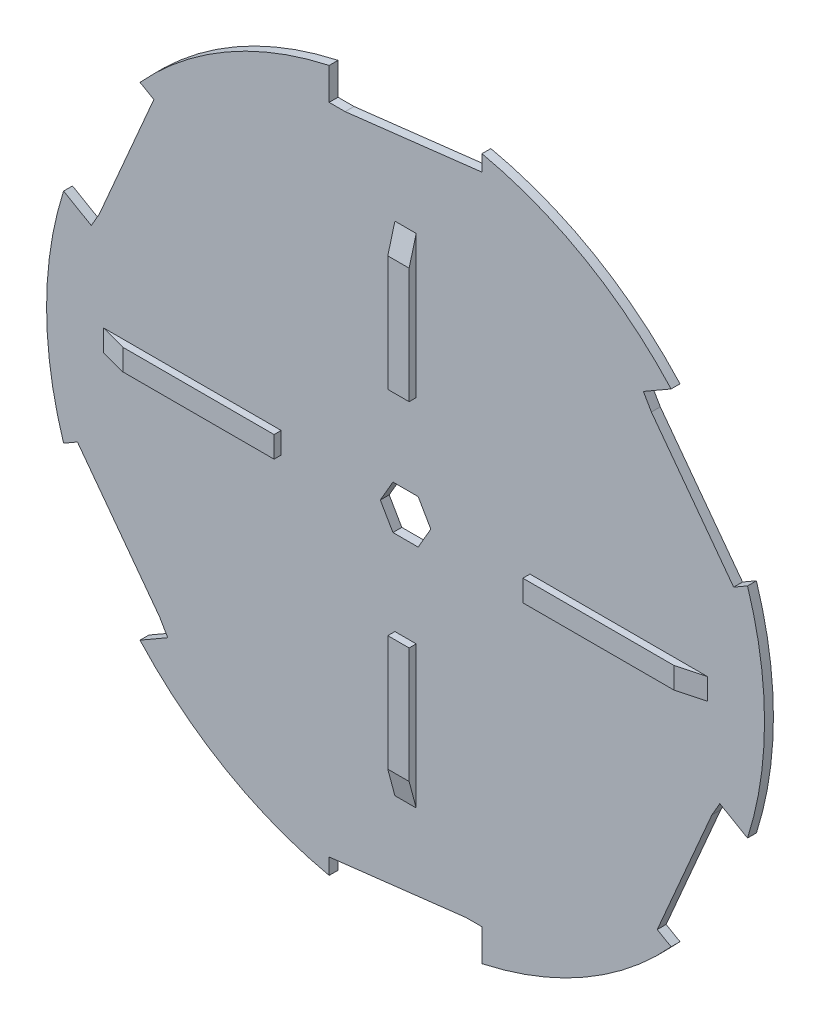
from build123d import *
from OCP.BRepFilletAPI import BRepFilletAPI_MakeChamfer

# Parameters (mm, degrees)
SKETCH1_R           = 101
BOSS_EXTRUDE1_DEPTH = 2.5
SKETCH8_W           = 1.221153846
SKETCH8_H           = 0.325641026
CUT_EXTRUDE6_DEPTH  = 0.2
CUT_EXTRUDE7_DEPTH  = 10
BOSS_EXTRUDE2_DEPTH = 2
CHAMFER1_SIZE       = 2
CHAMFER1_SIZE_2     = 7.464101615
CUT_EXTRUDE9_DEPTH  = 10


with BuildPart() as part:
    # Sketch1 → Boss-Extrude1 (new body)
    with BuildSketch(Plane.XY):
        Circle(SKETCH1_R)
    extrude(amount=BOSS_EXTRUDE1_DEPTH)

    # Sketch8 → Cut-Extrude6 (cut)
    # profile 1 of 12: a face of its own
    with BuildSketch(Plane(origin=(0, 0, 0), x_dir=(-1, 0, 0), z_dir=(0, 0, -1))):
        with BuildLine():
            add(Edge.make_bspline(
                [(-21.303796635, -42.5044388), (-21.303499075, -42.453550456), (-21.302921062, -42.354699113), (-21.296490852, -42.210658759), (-21.285808934, -42.075530497), (-21.271170032, -41.949307858), (-21.253355578, -41.831958258), (-21.229574387, -41.723795299), (-21.202529916, -41.62431837), (-21.171185911, -41.533203084), (-21.135818417, -41.449221882), (-21.09732448, -41.370821878), (-21.054176417, -41.298121696), (-21.008840217, -41.229960986), (-20.959480695, -41.167455492), (-20.907502507, -41.109722505), (-20.850876948, -41.058096324), (-20.791528933, -41.011064321), (-20.72892114, -40.969835158), (-20.66483815, -40.933519745), (-20.598838876, -40.902495579), (-20.530743124, -40.878102113), (-20.461162947, -40.857953702), (-20.389855107, -40.844175156), (-20.31670187, -40.835505675), (-20.267324783, -40.834676848), (-20.242283213, -40.834256508)],
                knots=[0, 0, 0, 0, 1.646270934, 3.197905019, 4.663502075, 6.030701355, 7.308322542, 8.50163776, 9.611534131, 10.641858119, 11.616356847, 12.558055219, 13.465016945, 14.349605745, 15.204443733, 16.039544428, 16.859896111, 17.680448484, 18.487036065, 19.28249412, 20.06191084, 20.843045899, 21.620316918, 22.403196591, 23.190181807, 24, 24, 24, 24], degree=3))
            add(Edge.make_bspline(
                [(-20.242283213, -40.834256508), (-20.217032458, -40.834699027), (-20.16681665, -40.835579056), (-20.092575738, -40.844037204), (-20.020049955, -40.858071722), (-19.949548501, -40.877957178), (-19.880492263, -40.902627542), (-19.813421379, -40.933549427), (-19.747919241, -40.969543828), (-19.685026766, -41.011838345), (-19.624053507, -41.058993695), (-19.566497141, -41.112299831), (-19.512352427, -41.171218505), (-19.460939829, -41.235119338), (-19.413717966, -41.305227951), (-19.368747781, -41.380324965), (-19.328496005, -41.461723678), (-19.28972955, -41.548065959), (-19.256267783, -41.64174085), (-19.226090547, -41.742220311), (-19.201707482, -41.850691181), (-19.181397214, -41.966584346), (-19.165662915, -42.09032542), (-19.154203304, -42.221649149), (-19.148149863, -42.360641932), (-19.147009855, -42.455672267), (-19.14642484, -42.5044388)],
                knots=[0, 0, 0, 0, 0.810914788, 1.612654377, 2.396697861, 3.181598691, 3.963628158, 4.749916497, 5.551656086, 6.361998678, 7.18212741, 8.025565596, 8.878627764, 9.750805457, 10.657531673, 11.591944965, 12.560506719, 13.57287815, 14.630710178, 15.753379473, 16.941251878, 18.199788006, 19.531962791, 20.947069417, 22.433333509, 24, 24, 24, 24], degree=3))
            add(Edge.make_bspline(
                [(-19.14642484, -42.5044388), (-19.14701592, -42.552992631), (-19.148167616, -42.64759779), (-19.154135443, -42.785965175), (-19.165890773, -42.916591971), (-19.180595548, -43.039791462), (-19.200961778, -43.155050874), (-19.226003608, -43.262769052), (-19.253807829, -43.363411174), (-19.288129392, -43.456152753), (-19.325694822, -43.54228753), (-19.366566322, -43.622721301), (-19.41035395, -43.698165009), (-19.458059454, -43.768014779), (-19.508907908, -43.832765418), (-19.563987616, -43.891273976), (-19.621745933, -43.944950228), (-19.682898624, -43.992712776), (-19.74677196, -44.034518277), (-19.812049122, -44.071905127), (-19.879888334, -44.102051929), (-19.948752227, -44.127937288), (-20.019625817, -44.147713412), (-20.092420757, -44.161387553), (-20.166766771, -44.170977729), (-20.217023905, -44.171709322), (-20.242283213, -44.172077021)],
                knots=[0, 0, 0, 0, 1.561518951, 3.042555995, 4.452378317, 5.7783523, 7.031515105, 8.214008947, 9.334062868, 10.386615937, 11.391082383, 12.354592575, 13.286541444, 14.194233754, 15.072674879, 15.931287219, 16.775624067, 17.606195743, 18.42308326, 19.229000347, 20.022332153, 20.807536673, 21.593273796, 22.3848459, 23.188221202, 24, 24, 24, 24], degree=3))
            add(Edge.make_bspline(
                [(-20.242283213, -44.172077021), (-20.267324088, -44.17165397), (-20.316699806, -44.170819796), (-20.389863077, -44.162189483), (-20.460876437, -44.148314276), (-20.530090306, -44.128886357), (-20.597859788, -44.105105755), (-20.663261419, -44.074123485), (-20.72702239, -44.038441865), (-20.788972587, -43.997806019), (-20.847947904, -43.951249921), (-20.904280211, -43.899756602), (-20.956554335, -43.842041078), (-21.005208122, -43.779014677), (-21.051448902, -43.711257236), (-21.093984262, -43.63784364), (-21.133327822, -43.559064986), (-21.169290132, -43.47441231), (-21.201174991, -43.38265034), (-21.229339697, -43.282729299), (-21.25157754, -43.173767258), (-21.270612078, -43.056639361), (-21.285964912, -42.930842295), (-21.296446335, -42.796307768), (-21.302924528, -42.653119614), (-21.303500628, -42.554903462), (-21.303796635, -42.5044388)],
                knots=[0, 0, 0, 0, 0.810891512, 1.598919785, 2.382837074, 3.152667961, 3.926044502, 4.706494248, 5.493654104, 6.291793342, 7.103789334, 7.925228297, 8.761435821, 9.622817696, 10.50288917, 11.416980706, 12.369136599, 13.353924996, 14.394355917, 15.514179734, 16.714354668, 17.994756427, 19.357759367, 20.818452758, 22.365282078, 24, 24, 24, 24], degree=3))
        make_face()
        with BuildLine():
            add(Edge.make_bspline(
                [(-21.018860737, -42.503166765), (-21.018752382, -42.545574513), (-21.018542085, -42.627879625), (-21.013048246, -42.747480298), (-21.005564107, -42.859031953), (-20.99591093, -42.962676233), (-20.981575398, -43.058062315), (-20.965512812, -43.145846242), (-20.945965617, -43.22556345), (-20.922837993, -43.297760964), (-20.896495384, -43.363664048), (-20.867733636, -43.424988007), (-20.836835695, -43.482457264), (-20.802256179, -43.535555608), (-20.764596086, -43.5844562), (-20.724706058, -43.630024555), (-20.681097357, -43.670661817), (-20.620768962, -43.71939975), (-20.541125017, -43.769763535), (-20.440776462, -43.813620345), (-20.337662938, -43.841181574), (-20.267675733, -43.844686552), (-20.232742949, -43.846435996)],
                knots=[0, 0, 0, 0, 1.459021318, 2.831673884, 4.118529203, 5.306027144, 6.411944654, 7.436330062, 8.375795394, 9.233974572, 10.042671642, 10.816086306, 11.563610507, 12.285937304, 12.993564865, 13.685989202, 14.367179055, 15.041617293, 16.353048772, 17.594441528, 18.799311195, 20, 20, 20, 20], degree=3))
            add(Edge.make_bspline(
                [(-20.232742949, -43.846435996), (-20.197584204, -43.84498658), (-20.127339304, -43.842090742), (-20.024710789, -43.814151887), (-19.925079044, -43.771997376), (-19.846999499, -43.722152139), (-19.787597477, -43.674682869), (-19.745037065, -43.63421101), (-19.705973635, -43.588893901), (-19.668924038, -43.53999954), (-19.634943305, -43.486593787), (-19.604043173, -43.42893345), (-19.575846137, -43.36685841), (-19.559781502, -43.323524433), (-19.551568069, -43.301368888)],
                knots=[0, 0, 0, 0, 1.353760809, 2.704726607, 4.075137775, 5.516104923, 6.260822281, 7.007110065, 7.778089737, 8.566572457, 9.372053459, 10.217411131, 11.088608312, 12, 12, 12, 12], degree=3))
            add(Edge.make_bspline(
                [(-19.551568069, -43.301368888), (-19.541996108, -43.273039053), (-19.522560923, -43.215517338), (-19.497513099, -43.126287454), (-19.477786916, -43.032667804), (-19.460040148, -42.935217877), (-19.447927019, -42.833219005), (-19.438177217, -42.726986785), (-19.432434379, -42.616441121), (-19.431722498, -42.541334236), (-19.431360737, -42.503166765)],
                knots=[0, 0, 0, 0, 0.884706709, 1.796334032, 2.740027952, 3.714592787, 4.726048262, 5.777819803, 6.87074269, 8, 8, 8, 8], degree=3))
            add(Edge.make_bspline(
                [(-19.431360737, -42.503166765), (-19.431859838, -42.465005467), (-19.432836184, -42.39035381), (-19.436568159, -42.281026604), (-19.446205259, -42.177187992), (-19.456908745, -42.078390635), (-19.47269051, -41.985181431), (-19.48970652, -41.896780083), (-19.51256762, -41.814281768), (-19.536987702, -41.736394861), (-19.564937132, -41.664004268), (-19.595703548, -41.596772476), (-19.628561858, -41.534374904), (-19.66425089, -41.47698275), (-19.702346974, -41.424338943), (-19.743855608, -41.377498989), (-19.787130289, -41.335011168), (-19.847743022, -41.286512981), (-19.927094699, -41.237063086), (-20.025833251, -41.191555575), (-20.128585906, -41.165422338), (-20.198048968, -41.161737808), (-20.232742949, -41.159897534)],
                knots=[0, 0, 0, 0, 1.31362396, 2.569729283, 3.763502607, 4.902122613, 5.988968491, 7.01645872, 7.998833611, 8.933434873, 9.825090667, 10.667526885, 11.477055099, 12.250526234, 12.991942729, 13.710640831, 14.402115721, 15.076753259, 16.378508321, 17.609869233, 18.806226677, 20, 20, 20, 20], degree=3))
            add(Edge.make_bspline(
                [(-20.232742949, -41.159897534), (-20.267858986, -41.161740346), (-20.338155033, -41.165429328), (-20.441975678, -41.191458208), (-20.541493197, -41.236827113), (-20.620635038, -41.286676765), (-20.681290045, -41.334155091), (-20.724000774, -41.375327088), (-20.764047658, -41.420363333), (-20.800939072, -41.469713642), (-20.835491493, -41.522750082), (-20.867224269, -41.57988989), (-20.895814989, -41.641422628), (-20.922198819, -41.707296108), (-20.945396991, -41.779487394), (-20.964532229, -41.859106409), (-20.98220977, -41.946611125), (-20.994724049, -42.042513822), (-21.005849028, -42.146184061), (-21.012998536, -42.2580142), (-21.018560463, -42.377815459), (-21.018758641, -42.460546124), (-21.018860737, -42.503166765)],
                knots=[0, 0, 0, 0, 1.207732386, 2.417664972, 3.655092373, 4.956220595, 5.625982001, 6.301752483, 6.994047911, 7.697131622, 8.419323945, 9.170223765, 9.943494443, 10.752040957, 11.610060368, 12.549350801, 13.567764191, 14.679664412, 15.874934091, 17.154273443, 18.533957287, 20, 20, 20, 20], degree=3))
        make_face(mode=Mode.SUBTRACT)
    # profile 2 of 12: a face of its own
    with BuildSketch(Plane(origin=(0, 0, 0), x_dir=(-1, 0, 0), z_dir=(0, 0, -1))):
        with BuildLine():
            Line((-18.45443766, -41.892589842), (-18.739373558, -41.892589842))
            add(Edge.make_bspline(
                [(-18.739373558, -41.892589842), (-18.737516498, -41.854788394), (-18.733869281, -41.780547355), (-18.716789333, -41.672303526), (-18.692350108, -41.56883953), (-18.657795718, -41.470986108), (-18.614882166, -41.377878047), (-18.563419927, -41.289885176), (-18.502465505, -41.207343169), (-18.433335111, -41.131017218), (-18.358252131, -41.060997065), (-18.277238886, -41.000531237), (-18.19210804, -40.949443064), (-18.103117871, -40.906733652), (-18.00926436, -40.874675363), (-17.911399196, -40.85088859), (-17.809092408, -40.836577191), (-17.73938753, -40.835038871), (-17.703936859, -40.834256508)],
                knots=[0, 0, 0, 0, 1.10065271, 2.161652631, 3.183658789, 4.190468796, 5.17591951, 6.163126047, 7.15150782, 8.156236427, 9.156009102, 10.134482811, 11.092018607, 12.041330605, 13.001268258, 13.972401359, 14.968799086, 16, 16, 16, 16], degree=3))
            add(Edge.make_bspline(
                [(-17.703936859, -40.834256508), (-17.669122463, -40.835071537), (-17.600713419, -40.836673038), (-17.500871449, -40.850426258), (-17.405823475, -40.871966902), (-17.315755287, -40.902188744), (-17.231385499, -40.942814617), (-17.152080309, -40.99161667), (-17.076895574, -41.048058946), (-17.009216563, -41.114510619), (-16.947069948, -41.185451354), (-16.893455759, -41.261186809), (-16.84754239, -41.33940909), (-16.809272137, -41.420714673), (-16.781099783, -41.505869105), (-16.75971098, -41.593632639), (-16.747621111, -41.684913718), (-16.74576562, -41.746696093), (-16.744822276, -41.778106669)],
                knots=[0, 0, 0, 0, 1.111607364, 2.184268762, 3.212621178, 4.221274766, 5.211760367, 6.196651075, 7.1921475, 8.207485113, 9.220403448, 10.201281604, 11.166441695, 12.114753415, 13.065576456, 14.026450734, 14.996634279, 16, 16, 16, 16], degree=3))
            add(Edge.make_bspline(
                [(-16.744822276, -41.778106669), (-16.746358307, -41.822327919), (-16.749403415, -41.909994398), (-16.775451456, -42.038822167), (-16.816133648, -42.163639054), (-16.865116965, -42.264093606), (-16.914531253, -42.345041133), (-16.959060635, -42.411687744), (-17.011189428, -42.483447704), (-17.071676351, -42.560080718), (-17.139270171, -42.642187039), (-17.214583134, -42.729717067), (-17.298152292, -42.821766459), (-17.356806789, -42.88463654), (-17.38720008, -42.917214241)],
                knots=[0, 0, 0, 0, 1.184426356, 2.348067706, 3.509069118, 4.696110526, 5.333549288, 6.050745305, 6.844228056, 7.710549037, 8.667450064, 9.695053472, 10.805634456, 12, 12, 12, 12], degree=3))
            Line((-17.38720008, -42.917214241), (-18.181586098, -43.765025739))
            Line((-18.181586098, -43.765025739), (-16.704117148, -43.765025739))
            Line((-16.704117148, -43.765025739), (-16.704117148, -44.090666765))
            Line((-16.704117148, -44.090666765), (-18.861488943, -44.090666765))
            Line((-18.861488943, -44.090666765), (-17.630158814, -42.776654345))
            add(Edge.make_bspline(
                [(-17.630158814, -42.776654345), (-17.60017966, -42.745359453), (-17.54259584, -42.685248369), (-17.461150216, -42.597488684), (-17.387999134, -42.516073029), (-17.322669071, -42.441155231), (-17.266577248, -42.371639452), (-17.216800295, -42.309777114), (-17.176917223, -42.252849863), (-17.133632542, -42.186863734), (-17.091709859, -42.106298275), (-17.055685079, -42.007842714), (-17.033718752, -41.906490135), (-17.031083652, -41.837999001), (-17.029758173, -41.803547374)],
                knots=[0, 0, 0, 0, 1.329631726, 2.553950428, 3.673215718, 4.687767853, 5.603093632, 6.413772471, 7.123043292, 7.734684054, 8.834405432, 9.900288307, 10.943827018, 12, 12, 12, 12], degree=3))
            add(Edge.make_bspline(
                [(-17.029758173, -41.803547374), (-17.030334882, -41.781883534), (-17.031471465, -41.739188265), (-17.041502377, -41.676590184), (-17.056661193, -41.616206389), (-17.078382963, -41.557851141), (-17.107054791, -41.502111157), (-17.141955643, -41.448918586), (-17.182223772, -41.397493596), (-17.228806709, -41.349275961), (-17.279980016, -41.305115153), (-17.334040514, -41.265995447), (-17.391235966, -41.233302825), (-17.451325219, -41.206502653), (-17.514140752, -41.185479271), (-17.579804057, -41.170911846), (-17.6481337, -41.161765592), (-17.694791229, -41.160528093), (-17.718565265, -41.159897534)],
                knots=[0, 0, 0, 0, 0.991446411, 1.95395049, 2.89581595, 3.838931463, 4.798493298, 5.75982156, 6.748411868, 7.785213223, 8.824556874, 9.840280684, 10.836137867, 11.835679398, 12.848801643, 13.863922112, 14.911575587, 16, 16, 16, 16], degree=3))
            add(Edge.make_bspline(
                [(-17.718565265, -41.159897534), (-17.74339452, -41.160546171), (-17.792155078, -41.161819985), (-17.863745915, -41.170730545), (-17.93204087, -41.186102843), (-17.997211739, -41.207127398), (-18.059368792, -41.23385051), (-18.118209747, -41.267135164), (-18.17360251, -41.306853047), (-18.225651214, -41.351884123), (-18.273606395, -41.402019733), (-18.315740346, -41.457908771), (-18.352555845, -41.518530783), (-18.384677078, -41.583722197), (-18.410762597, -41.654074554), (-18.430695384, -41.729338115), (-18.446467737, -41.809186083), (-18.451736895, -41.864326838), (-18.45443766, -41.892589842)],
                knots=[0, 0, 0, 0, 1.031018746, 2.02475058, 2.990194455, 3.934040569, 4.864654155, 5.795059489, 6.735614925, 7.690564532, 8.649604399, 9.611025574, 10.590972636, 11.591080095, 12.624614302, 13.701020113, 14.821632451, 16, 16, 16, 16], degree=3))
        make_face()
    # profile 3 of 12: a face of its own
    with BuildSketch(Plane(origin=(0, 0, 0), x_dir=(-1, 0, 0), z_dir=(0, 0, -1))):
        with Locations((-15.808604327, -42.869512919)):
            Rectangle(SKETCH8_W, SKETCH8_H)
    # profile 4 of 12: a face of its own
    with BuildSketch(Plane(origin=(0, 0, 0), x_dir=(-1, 0, 0), z_dir=(0, 0, -1))):
        with BuildLine():
            add(Edge.make_bspline(
                [(-14.953796635, -42.5044388), (-14.953499075, -42.453550456), (-14.952921062, -42.354699113), (-14.946490852, -42.210658759), (-14.935808934, -42.075530497), (-14.921170032, -41.949307858), (-14.903355578, -41.831958258), (-14.879574387, -41.723795299), (-14.852529916, -41.62431837), (-14.821185911, -41.533203084), (-14.785818417, -41.449221882), (-14.74732448, -41.370821878), (-14.704176417, -41.298121696), (-14.658840217, -41.229960986), (-14.609480695, -41.167455492), (-14.557502507, -41.109722505), (-14.500876948, -41.058096324), (-14.441528933, -41.011064321), (-14.37892114, -40.969835158), (-14.31483815, -40.933519745), (-14.248838876, -40.902495579), (-14.180743124, -40.878102113), (-14.111162947, -40.857953702), (-14.039855107, -40.844175156), (-13.96670187, -40.835505675), (-13.917324783, -40.834676848), (-13.892283213, -40.834256508)],
                knots=[0, 0, 0, 0, 1.646270934, 3.197905019, 4.663502075, 6.030701355, 7.308322542, 8.50163776, 9.611534131, 10.641858119, 11.616356847, 12.558055219, 13.465016945, 14.349605745, 15.204443733, 16.039544428, 16.859896111, 17.680448484, 18.487036065, 19.28249412, 20.06191084, 20.843045899, 21.620316918, 22.403196591, 23.190181807, 24, 24, 24, 24], degree=3))
            add(Edge.make_bspline(
                [(-13.892283213, -40.834256508), (-13.867032458, -40.834699027), (-13.81681665, -40.835579056), (-13.742575738, -40.844037204), (-13.670049955, -40.858071722), (-13.599548501, -40.877957178), (-13.530492263, -40.902627542), (-13.463421379, -40.933549427), (-13.397919241, -40.969543828), (-13.335026766, -41.011838345), (-13.274053507, -41.058993695), (-13.216497141, -41.112299831), (-13.162352427, -41.171218505), (-13.110939829, -41.235119338), (-13.063717966, -41.305227951), (-13.018747781, -41.380324965), (-12.978496005, -41.461723678), (-12.93972955, -41.548065959), (-12.906267783, -41.64174085), (-12.876090547, -41.742220311), (-12.851707482, -41.850691181), (-12.831397214, -41.966584346), (-12.815662915, -42.09032542), (-12.804203304, -42.221649149), (-12.798149863, -42.360641932), (-12.797009855, -42.455672267), (-12.79642484, -42.5044388)],
                knots=[0, 0, 0, 0, 0.810914788, 1.612654377, 2.396697861, 3.181598691, 3.963628158, 4.749916497, 5.551656086, 6.361998678, 7.18212741, 8.025565596, 8.878627764, 9.750805457, 10.657531673, 11.591944965, 12.560506719, 13.57287815, 14.630710178, 15.753379473, 16.941251878, 18.199788006, 19.531962791, 20.947069417, 22.433333509, 24, 24, 24, 24], degree=3))
            add(Edge.make_bspline(
                [(-12.79642484, -42.5044388), (-12.79701592, -42.552992631), (-12.798167616, -42.64759779), (-12.804135443, -42.785965175), (-12.815890773, -42.916591971), (-12.830595548, -43.039791462), (-12.850961778, -43.155050874), (-12.876003608, -43.262769052), (-12.903807829, -43.363411174), (-12.938129392, -43.456152753), (-12.975694822, -43.54228753), (-13.016566322, -43.622721301), (-13.06035395, -43.698165009), (-13.108059454, -43.768014779), (-13.158907908, -43.832765418), (-13.213987616, -43.891273976), (-13.271745933, -43.944950228), (-13.332898624, -43.992712776), (-13.39677196, -44.034518277), (-13.462049122, -44.071905127), (-13.529888334, -44.102051929), (-13.598752227, -44.127937288), (-13.669625817, -44.147713412), (-13.742420757, -44.161387553), (-13.816766771, -44.170977729), (-13.867023905, -44.171709322), (-13.892283213, -44.172077021)],
                knots=[0, 0, 0, 0, 1.561518951, 3.042555995, 4.452378317, 5.7783523, 7.031515105, 8.214008947, 9.334062868, 10.386615937, 11.391082383, 12.354592575, 13.286541444, 14.194233754, 15.072674879, 15.931287219, 16.775624067, 17.606195743, 18.42308326, 19.229000347, 20.022332153, 20.807536673, 21.593273796, 22.3848459, 23.188221202, 24, 24, 24, 24], degree=3))
            add(Edge.make_bspline(
                [(-13.892283213, -44.172077021), (-13.917324088, -44.17165397), (-13.966699806, -44.170819796), (-14.039863077, -44.162189483), (-14.110876437, -44.148314276), (-14.180090306, -44.128886357), (-14.247859788, -44.105105755), (-14.313261419, -44.074123485), (-14.37702239, -44.038441865), (-14.438972587, -43.997806019), (-14.497947904, -43.951249921), (-14.554280211, -43.899756602), (-14.606554335, -43.842041078), (-14.655208122, -43.779014677), (-14.701448902, -43.711257236), (-14.743984262, -43.63784364), (-14.783327822, -43.559064986), (-14.819290132, -43.47441231), (-14.851174991, -43.38265034), (-14.879339697, -43.282729299), (-14.90157754, -43.173767258), (-14.920612078, -43.056639361), (-14.935964912, -42.930842295), (-14.946446335, -42.796307768), (-14.952924528, -42.653119614), (-14.953500628, -42.554903462), (-14.953796635, -42.5044388)],
                knots=[0, 0, 0, 0, 0.810891512, 1.598919785, 2.382837074, 3.152667961, 3.926044502, 4.706494248, 5.493654104, 6.291793342, 7.103789334, 7.925228297, 8.761435821, 9.622817696, 10.50288917, 11.416980706, 12.369136599, 13.353924996, 14.394355917, 15.514179734, 16.714354668, 17.994756427, 19.357759367, 20.818452758, 22.365282078, 24, 24, 24, 24], degree=3))
        make_face()
        with BuildLine():
            add(Edge.make_bspline(
                [(-14.668860737, -42.503166765), (-14.668752382, -42.545574513), (-14.668542085, -42.627879625), (-14.663048246, -42.747480298), (-14.655564107, -42.859031953), (-14.64591093, -42.962676233), (-14.631575398, -43.058062315), (-14.615512812, -43.145846242), (-14.595965617, -43.22556345), (-14.572837993, -43.297760964), (-14.546495384, -43.363664048), (-14.517733636, -43.424988007), (-14.486835695, -43.482457264), (-14.452256179, -43.535555608), (-14.414596086, -43.5844562), (-14.374706058, -43.630024555), (-14.331097357, -43.670661817), (-14.270768962, -43.71939975), (-14.191125017, -43.769763535), (-14.090776462, -43.813620345), (-13.987662938, -43.841181574), (-13.917675733, -43.844686552), (-13.882742949, -43.846435996)],
                knots=[0, 0, 0, 0, 1.459021318, 2.831673884, 4.118529203, 5.306027144, 6.411944654, 7.436330062, 8.375795394, 9.233974572, 10.042671642, 10.816086306, 11.563610507, 12.285937304, 12.993564865, 13.685989202, 14.367179055, 15.041617293, 16.353048772, 17.594441528, 18.799311195, 20, 20, 20, 20], degree=3))
            add(Edge.make_bspline(
                [(-13.882742949, -43.846435996), (-13.847584204, -43.84498658), (-13.777339304, -43.842090742), (-13.674710789, -43.814151887), (-13.575079044, -43.771997376), (-13.496999499, -43.722152139), (-13.437597477, -43.674682869), (-13.395037065, -43.63421101), (-13.355973635, -43.588893901), (-13.318924038, -43.53999954), (-13.284943305, -43.486593787), (-13.254043173, -43.42893345), (-13.225846137, -43.36685841), (-13.209781502, -43.323524433), (-13.201568069, -43.301368888)],
                knots=[0, 0, 0, 0, 1.353760809, 2.704726607, 4.075137775, 5.516104923, 6.260822281, 7.007110065, 7.778089737, 8.566572457, 9.372053459, 10.217411131, 11.088608312, 12, 12, 12, 12], degree=3))
            add(Edge.make_bspline(
                [(-13.201568069, -43.301368888), (-13.191996108, -43.273039053), (-13.172560923, -43.215517338), (-13.147513099, -43.126287454), (-13.127786916, -43.032667804), (-13.110040148, -42.935217877), (-13.097927019, -42.833219005), (-13.088177217, -42.726986785), (-13.082434379, -42.616441121), (-13.081722498, -42.541334236), (-13.081360737, -42.503166765)],
                knots=[0, 0, 0, 0, 0.884706709, 1.796334032, 2.740027952, 3.714592787, 4.726048262, 5.777819803, 6.87074269, 8, 8, 8, 8], degree=3))
            add(Edge.make_bspline(
                [(-13.081360737, -42.503166765), (-13.081859838, -42.465005467), (-13.082836184, -42.39035381), (-13.086568159, -42.281026604), (-13.096205259, -42.177187992), (-13.106908745, -42.078390635), (-13.12269051, -41.985181431), (-13.13970652, -41.896780083), (-13.16256762, -41.814281768), (-13.186987702, -41.736394861), (-13.214937132, -41.664004268), (-13.245703548, -41.596772476), (-13.278561858, -41.534374904), (-13.31425089, -41.47698275), (-13.352346974, -41.424338943), (-13.393855608, -41.377498989), (-13.437130289, -41.335011168), (-13.497743022, -41.286512981), (-13.577094699, -41.237063086), (-13.675833251, -41.191555575), (-13.778585906, -41.165422338), (-13.848048968, -41.161737808), (-13.882742949, -41.159897534)],
                knots=[0, 0, 0, 0, 1.31362396, 2.569729283, 3.763502607, 4.902122613, 5.988968491, 7.01645872, 7.998833611, 8.933434873, 9.825090667, 10.667526885, 11.477055099, 12.250526234, 12.991942729, 13.710640831, 14.402115721, 15.076753259, 16.378508321, 17.609869233, 18.806226677, 20, 20, 20, 20], degree=3))
            add(Edge.make_bspline(
                [(-13.882742949, -41.159897534), (-13.917858986, -41.161740346), (-13.988155033, -41.165429328), (-14.091975678, -41.191458208), (-14.191493197, -41.236827113), (-14.270635038, -41.286676765), (-14.331290045, -41.334155091), (-14.374000774, -41.375327088), (-14.414047658, -41.420363333), (-14.450939072, -41.469713642), (-14.485491493, -41.522750082), (-14.517224269, -41.57988989), (-14.545814989, -41.641422628), (-14.572198819, -41.707296108), (-14.595396991, -41.779487394), (-14.614532229, -41.859106409), (-14.63220977, -41.946611125), (-14.644724049, -42.042513822), (-14.655849028, -42.146184061), (-14.662998536, -42.2580142), (-14.668560463, -42.377815459), (-14.668758641, -42.460546124), (-14.668860737, -42.503166765)],
                knots=[0, 0, 0, 0, 1.207732386, 2.417664972, 3.655092373, 4.956220595, 5.625982001, 6.301752483, 6.994047911, 7.697131622, 8.419323945, 9.170223765, 9.943494443, 10.752040957, 11.610060368, 12.549350801, 13.567764191, 14.679664412, 15.874934091, 17.154273443, 18.533957287, 20, 20, 20, 20], degree=3))
        make_face(mode=Mode.SUBTRACT)
    # profile 5 of 12: a face of its own
    with BuildSketch(Plane(origin=(0, 0, 0), x_dir=(-1, 0, 0), z_dir=(0, 0, -1))):
        Polygon((-10.778340906, -40.834256508), (-10.720463301, -40.834256508), (-10.720463301, -43.032333432), (-10.354117148, -43.032333432), (-10.354117148, -43.357974457), (-10.720463301, -43.357974457), (-10.720463301, -44.090666765), (-11.005399199, -44.090666765), (-11.005399199, -43.357974457), (-12.511488943, -43.357974457), align=None)
        Polygon((-11.005399199, -43.032333432), (-11.005399199, -41.653447214), (-11.95179343, -43.032333432), align=None, mode=Mode.SUBTRACT)
    # profile 6 of 12: a face of its own
    with BuildSketch(Plane(origin=(0, 0, 0), x_dir=(-1, 0, 0), z_dir=(0, 0, -1))):
        with Locations((-9.458604327, -42.869512919)):
            Rectangle(SKETCH8_W, SKETCH8_H)
    # profile 7 of 12: a face of its own
    with BuildSketch(Plane(origin=(0, 0, 0), x_dir=(-1, 0, 0), z_dir=(0, 0, -1))):
        Polygon((-7.928981931, -40.915666765), (-7.34193766, -40.915666765), (-7.34193766, -44.090666765), (-7.626873558, -44.090666765), (-7.626873558, -41.241307791), (-8.115335096, -41.241307791), align=None)
    # profile 8 of 12: a face of its own
    with BuildSketch(Plane(origin=(0, 0, 0), x_dir=(-1, 0, 0), z_dir=(0, 0, -1))):
        Polygon((-4.428340906, -40.834256508), (-4.370463301, -40.834256508), (-4.370463301, -43.032333432), (-4.004117148, -43.032333432), (-4.004117148, -43.357974457), (-4.370463301, -43.357974457), (-4.370463301, -44.090666765), (-4.655399199, -44.090666765), (-4.655399199, -43.357974457), (-6.161488943, -43.357974457), align=None)
        Polygon((-4.655399199, -43.032333432), (-4.655399199, -41.653447214), (-5.60179343, -43.032333432), align=None, mode=Mode.SUBTRACT)
    # profile 9 of 12: a face of its own
    with BuildSketch(Plane(origin=(0, 0, 0), x_dir=(-1, 0, 0), z_dir=(0, 0, -1))):
        Polygon((-3.044366547, -40.915666765), (-2.457322276, -40.915666765), (-2.457322276, -44.090666765), (-2.742258173, -44.090666765), (-2.742258173, -41.241307791), (-3.230719712, -41.241307791), align=None)
    # profile 10 of 12: a face of its own
    with BuildSketch(Plane(origin=(0, 0, 0), x_dir=(-1, 0, 0), z_dir=(0, 0, -1))):
        Polygon((-0.602058854, -40.915666765), (-0.015014584, -40.915666765), (-0.015014584, -44.090666765), (-0.299950481, -44.090666765), (-0.299950481, -41.241307791), (-0.788412019, -41.241307791), align=None)
    # profile 11 of 12: a face of its own
    with BuildSketch(Plane(origin=(0, 0, 0), x_dir=(-1, 0, 0), z_dir=(0, 0, -1))):
        Polygon((1.840248838, -40.915666765), (2.427293109, -40.915666765), (2.427293109, -44.090666765), (2.142357211, -44.090666765), (2.142357211, -41.241307791), (1.653895673, -41.241307791), align=None)
    # profile 12 of 12: a face of its own
    with BuildSketch(Plane(origin=(0, 0, 0), x_dir=(-1, 0, 0), z_dir=(0, 0, -1))):
        with BuildLine():
            add(Edge.make_bspline(
                [(5.15135661, -42.321901741), (5.177344935, -42.335452601), (5.228030848, -42.361881304), (5.300218744, -42.404436126), (5.36619071, -42.449286144), (5.427777148, -42.494312959), (5.483896045, -42.541240957), (5.533919905, -42.590256749), (5.579084389, -42.640136857), (5.618478685, -42.691725926), (5.653128673, -42.7448869), (5.683075396, -42.799759312), (5.70867243, -42.856222908), (5.72895881, -42.914894032), (5.745670007, -42.974910841), (5.757168591, -43.037048296), (5.763352509, -43.100896948), (5.764521647, -43.144048193), (5.765113622, -43.165897133)],
                knots=[0, 0, 0, 0, 1.272397273, 2.481599622, 3.635517121, 4.734568067, 5.792894095, 6.808321871, 7.773003508, 8.711915296, 9.623354172, 10.525449501, 11.423591555, 12.311487226, 13.218079475, 14.126165749, 15.051214107, 16, 16, 16, 16], degree=3))
            add(Edge.make_bspline(
                [(5.765113622, -43.165897133), (5.764413833, -43.196465791), (5.763028689, -43.256972634), (5.750963703, -43.346277321), (5.732899787, -43.433010866), (5.706520515, -43.517154254), (5.672309082, -43.598243185), (5.630147952, -43.676347073), (5.582422073, -43.752746017), (5.544093256, -43.799753618), (5.524698958, -43.823539361)],
                knots=[0, 0, 0, 0, 1.025265484, 2.029385089, 3.018602448, 3.995076438, 4.983346944, 5.966715145, 6.97116228, 8, 8, 8, 8], degree=3))
            add(Edge.make_bspline(
                [(5.524698958, -43.823539361), (5.499447299, -43.851292285), (5.449256023, -43.906455182), (5.363274368, -43.978074845), (5.268911659, -44.038263224), (5.166533028, -44.087314157), (5.056412144, -44.125492043), (4.938572468, -44.152926327), (4.812784272, -44.168640245), (4.726328595, -44.170911722), (4.681975601, -44.172077021)],
                knots=[0, 0, 0, 0, 0.954267603, 1.896743057, 2.838368354, 3.796610408, 4.779680527, 5.799409237, 6.871065594, 8, 8, 8, 8], degree=3))
            add(Edge.make_bspline(
                [(4.681975601, -44.172077021), (4.639327741, -44.171031559), (4.556339338, -44.168997196), (4.435546121, -44.155213676), (4.322948764, -44.131058397), (4.217892579, -44.09799793), (4.121010907, -44.05499008), (4.032579808, -44.001461023), (3.951323419, -43.939565358), (3.879707689, -43.867525444), (3.816127458, -43.790365803), (3.760276439, -43.710762557), (3.713854239, -43.62870844), (3.674550374, -43.545426949), (3.644462239, -43.459750795), (3.623623162, -43.372120783), (3.61038857, -43.282689975), (3.608627684, -43.222336261), (3.607741827, -43.191973856)],
                knots=[0, 0, 0, 0, 1.256902934, 2.445805442, 3.576955095, 4.645999104, 5.686449165, 6.692658513, 7.68621702, 8.689161843, 9.678783111, 10.630372946, 11.551080876, 12.453998257, 13.34127905, 14.221779781, 15.105423033, 16, 16, 16, 16], degree=3))
            add(Edge.make_bspline(
                [(3.607741827, -43.191973856), (3.608266047, -43.169695161), (3.609302092, -43.125664595), (3.616472919, -43.06061399), (3.628001309, -42.997298924), (3.643658102, -42.935485536), (3.664877104, -42.875623838), (3.690496754, -42.817430194), (3.720370739, -42.760838905), (3.754915796, -42.705540491), (3.795104061, -42.652309791), (3.840609657, -42.600243424), (3.892342081, -42.550149302), (3.949725814, -42.501415388), (4.012105075, -42.453177183), (4.081100121, -42.408041629), (4.154881921, -42.362813333), (4.207319682, -42.335772923), (4.234219191, -42.321901741)],
                knots=[0, 0, 0, 0, 0.941657376, 1.861047343, 2.762797495, 3.66048619, 4.553285746, 5.444104102, 6.34607688, 7.256116206, 8.197091036, 9.162375105, 10.176350973, 11.237807142, 12.343728897, 13.50695164, 14.721116704, 16, 16, 16, 16], degree=3))
            add(Edge.make_bspline(
                [(4.234219191, -42.321901741), (4.197397015, -42.301822344), (4.126098976, -42.26294301), (4.031693126, -42.191508408), (3.950603061, -42.114140176), (3.88505771, -42.029204576), (3.833466474, -41.939354912), (3.798071026, -41.84515334), (3.774125644, -41.74834658), (3.771753622, -41.682210244), (3.77056234, -41.64899509)],
                knots=[0, 0, 0, 0, 1.166880483, 2.259407225, 3.286803203, 4.280235371, 5.237608625, 6.161067461, 7.076446754, 8, 8, 8, 8], degree=3))
            add(Edge.make_bspline(
                [(3.77056234, -41.64899509), (3.772045903, -41.615160877), (3.775028124, -41.547148206), (3.799142993, -41.445905509), (3.838440482, -41.346467625), (3.891890244, -41.249316514), (3.958462933, -41.157740248), (4.038333728, -41.075606675), (4.12959529, -41.00365983), (4.231792069, -40.943265731), (4.341770654, -40.894113412), (4.45780849, -40.860205842), (4.577883809, -40.838038794), (4.659615311, -40.835529043), (4.70105613, -40.834256508)],
                knots=[0, 0, 0, 0, 0.888701115, 1.786444228, 2.72001202, 3.692817113, 4.693886446, 5.687152267, 6.695133018, 7.739871481, 8.800368666, 9.853104506, 10.91144658, 12, 12, 12, 12], degree=3))
            add(Edge.make_bspline(
                [(4.70105613, -40.834256508), (4.741427447, -40.835568548), (4.821035087, -40.838155741), (4.938051642, -40.859733838), (5.050015638, -40.895774188), (5.156540969, -40.944666669), (5.255720592, -41.004889108), (5.343352687, -41.077824187), (5.420761529, -41.159595451), (5.484791658, -41.251143948), (5.537553708, -41.347921752), (5.574293811, -41.449179325), (5.597835959, -41.552728828), (5.600805368, -41.622794732), (5.602293109, -41.657899337)],
                knots=[0, 0, 0, 0, 1.072916533, 2.115669174, 3.151510826, 4.193348718, 5.225979165, 6.227137561, 7.216255879, 8.211077061, 9.189680878, 10.138522389, 11.067357538, 12, 12, 12, 12], degree=3))
            add(Edge.make_bspline(
                [(5.602293109, -41.657899337), (5.600991757, -41.692349596), (5.598435977, -41.760007948), (5.576936746, -41.858638434), (5.540729669, -41.951005569), (5.491295678, -42.038157462), (5.426865415, -42.118513535), (5.348298921, -42.193095618), (5.25622258, -42.262516384), (5.187043062, -42.301692586), (5.15135661, -42.321901741)],
                knots=[0, 0, 0, 0, 0.975232327, 1.915300861, 2.843280834, 3.77672583, 4.742871857, 5.749627742, 6.839139064, 8, 8, 8, 8], degree=3))
        make_face()
        with BuildLine():
            add(Edge.make_bspline(
                [(4.685155689, -41.159897534), (4.662884601, -41.160488484), (4.619312614, -41.16164464), (4.555423748, -41.167684975), (4.494670244, -41.179435393), (4.436417339, -41.195073367), (4.381463702, -41.216198899), (4.329062999, -41.241050086), (4.280107048, -41.271263445), (4.234004866, -41.305155389), (4.192502378, -41.342432525), (4.155668249, -41.381270685), (4.125072031, -41.422432647), (4.099090453, -41.464894516), (4.080238648, -41.509916539), (4.066119601, -41.556118392), (4.056575196, -41.604083919), (4.055860013, -41.636864897), (4.055498237, -41.653447214)],
                knots=[0, 0, 0, 0, 1.203892937, 2.355340988, 3.463153438, 4.544400666, 5.610487187, 6.640501085, 7.674077295, 8.714426146, 9.728707835, 10.68524104, 11.601827946, 12.495867327, 13.368432065, 14.231010473, 15.105153427, 16, 16, 16, 16], degree=3))
            add(Edge.make_bspline(
                [(4.055498237, -41.653447214), (4.056121777, -41.670030247), (4.057353982, -41.702800704), (4.066883633, -41.751193025), (4.081086637, -41.798746939), (4.103448309, -41.844331694), (4.13026922, -41.889528598), (4.163372201, -41.933208058), (4.202822962, -41.975522086), (4.247297855, -42.016110779), (4.29574975, -42.054118943), (4.34707956, -42.087114614), (4.400643073, -42.1147227), (4.45588995, -42.137700089), (4.513383256, -42.155561675), (4.572770699, -42.168233233), (4.634062262, -42.176109044), (4.675591789, -42.177049771), (4.696604006, -42.177525739)],
                knots=[0, 0, 0, 0, 0.873023192, 1.725219244, 2.590779336, 3.480155217, 4.391973325, 5.357036234, 6.360879153, 7.436073238, 8.526419356, 9.601555421, 10.645666583, 11.697338044, 12.750135903, 13.812665442, 14.89329948, 16, 16, 16, 16], degree=3))
            add(Edge.make_bspline(
                [(4.696604006, -42.177525739), (4.7235916, -42.176733924), (4.777300234, -42.175158114), (4.856475056, -42.160506692), (4.933457598, -42.137459896), (5.007425033, -42.105927641), (5.076462763, -42.066350939), (5.138003397, -42.01896813), (5.191522007, -41.964873299), (5.236462417, -41.904908584), (5.271305635, -41.841089643), (5.298430847, -41.777045091), (5.314270663, -41.712091639), (5.316336742, -41.66857875), (5.317357211, -41.647087037)],
                knots=[0, 0, 0, 0, 1.076279235, 2.141928126, 3.20205304, 4.278698113, 5.344010996, 6.36967002, 7.368914609, 8.37248503, 9.349703398, 10.264243087, 11.142681841, 12, 12, 12, 12], degree=3))
            add(Edge.make_bspline(
                [(5.317357211, -41.647087037), (5.316874704, -41.632003033), (5.315916997, -41.602063447), (5.308024803, -41.557850787), (5.294983869, -41.514643951), (5.277328075, -41.472086005), (5.254096333, -41.430774056), (5.226551677, -41.390058683), (5.193092165, -41.350855811), (5.155539686, -41.31225185), (5.112953494, -41.276524914), (5.065415659, -41.245106284), (5.0131699, -41.218425075), (4.956214981, -41.196754561), (4.894760657, -41.180478287), (4.829089978, -41.1682896), (4.758655372, -41.161419706), (4.710186955, -41.160415929), (4.685155689, -41.159897534)],
                knots=[0, 0, 0, 0, 0.814439003, 1.616544685, 2.417341072, 3.248991801, 4.09997495, 4.973547432, 5.9003056, 6.880240646, 7.880314356, 8.896779544, 9.951930927, 11.043077905, 12.18215768, 13.381699519, 14.647792085, 16, 16, 16, 16], degree=3))
        make_face(mode=Mode.SUBTRACT)
        with BuildLine():
            add(Edge.make_bspline(
                [(4.7036002, -42.503166765), (4.675364666, -42.503668997), (4.619973438, -42.504654253), (4.538823224, -42.515621157), (4.460942139, -42.530887821), (4.386592768, -42.554047938), (4.315806508, -42.584161897), (4.248200161, -42.62038823), (4.184290922, -42.663210311), (4.124961306, -42.712084098), (4.070783714, -42.764752317), (4.02325097, -42.820507253), (3.982885363, -42.878312694), (3.950379485, -42.938902788), (3.923698842, -43.000994549), (3.906178397, -43.066134296), (3.894946415, -43.133069749), (3.893438171, -43.178572124), (3.892677724, -43.201514121)],
                knots=[0, 0, 0, 0, 1.140299081, 2.23698856, 3.303958914, 4.344563908, 5.37730929, 6.408454204, 7.439741482, 8.480804886, 9.510774543, 10.48932336, 11.43758569, 12.353841022, 13.263987381, 14.161954604, 15.073269652, 16, 16, 16, 16], degree=3))
            add(Edge.make_bspline(
                [(3.892677724, -43.201514121), (3.893914395, -43.230026443), (3.89636792, -43.286594223), (3.915832157, -43.370199295), (3.947070107, -43.451135538), (3.990635838, -43.528743381), (4.044581422, -43.601269548), (4.110917575, -43.664487223), (4.185521764, -43.72065885), (4.270918245, -43.766089049), (4.364198354, -43.802370096), (4.465337279, -43.82736729), (4.572883527, -43.843914891), (4.647141871, -43.845582384), (4.685155689, -43.846435996)],
                knots=[0, 0, 0, 0, 0.898778495, 1.783155532, 2.693654817, 3.627872908, 4.583023416, 5.533784346, 6.509005473, 7.520592997, 8.575161974, 9.658835044, 10.801527049, 12, 12, 12, 12], degree=3))
            add(Edge.make_bspline(
                [(4.685155689, -43.846435996), (4.714864951, -43.845865577), (4.772748121, -43.844754217), (4.857190375, -43.834944108), (4.93687793, -43.819386948), (5.011656254, -43.796759589), (5.082362452, -43.76913711), (5.147797708, -43.733602436), (5.209645372, -43.693187114), (5.264857827, -43.645237215), (5.315143666, -43.594002245), (5.358988867, -43.539764134), (5.39705036, -43.483996954), (5.426923441, -43.425440443), (5.450805114, -43.365218027), (5.467971482, -43.302774385), (5.478563477, -43.237917995), (5.479634718, -43.193922409), (5.480177724, -43.171621292)],
                knots=[0, 0, 0, 0, 1.224942928, 2.386581632, 3.501229538, 4.569074225, 5.605009692, 6.626002462, 7.634866581, 8.645888296, 9.63523824, 10.59253846, 11.518950513, 12.414518923, 13.29783783, 14.186679152, 15.080837789, 16, 16, 16, 16], degree=3))
            add(Edge.make_bspline(
                [(5.480177724, -43.171621292), (5.47935599, -43.149961133), (5.477735674, -43.107251083), (5.467451676, -43.043962877), (5.44938513, -42.982818896), (5.424595277, -42.923083533), (5.391592547, -42.865967142), (5.352726129, -42.809981758), (5.305832178, -42.756681269), (5.252843609, -42.705651675), (5.195095837, -42.658465971), (5.13371207, -42.616724301), (5.069164808, -42.581570596), (5.001590638, -42.552980632), (4.931139606, -42.530494856), (4.857863528, -42.514786775), (4.781676614, -42.504899278), (4.729919695, -42.503750794), (4.7036002, -42.503166765)],
                knots=[0, 0, 0, 0, 0.917430815, 1.809013306, 2.70690318, 3.612392954, 4.541220862, 5.495268465, 6.494511384, 7.542276156, 8.608045339, 9.649016899, 10.681629292, 11.715607085, 12.752076957, 13.808767841, 14.885711793, 16, 16, 16, 16], degree=3))
        make_face(mode=Mode.SUBTRACT)
    extrude(amount=-CUT_EXTRUDE6_DEPTH, mode=Mode.SUBTRACT)

    # Sketch9 → Cut-Extrude7 (cut)
    with BuildSketch(Plane.XY.offset(2.5)):
        Polygon((-7.101408311, 0), (-3.550704156, -6.15), (3.550704156, -6.15), (7.101408311, 0), (3.550704156, 6.15), (-3.550704156, 6.15), align=None)
    extrude(amount=-CUT_EXTRUDE7_DEPTH, mode=Mode.SUBTRACT)

    # Sketch11 → Boss-Extrude2 (add)
    with BuildSketch(Plane.XY.offset(2.5)):
        Polygon((-85, 0), (-85, 3), (-35, 3), (-35, -3), (-85, -3), align=None)
        Polygon((0, 70), (-3, 70), (-3, 30), (3, 30), (3, 70), align=None)
        Polygon((35, 3), (85, 3), (85, 0), (85, -3), (35, -3), align=None)
        Polygon((3, -30), (-3, -30), (-3, -70), (0, -70), (3, -70), align=None)
    extrude(amount=BOSS_EXTRUDE2_DEPTH)

    # Chamfer1
    chamfer1_edges_1 = [part.edges().sort_by_distance(p)[0] for p in [
        (85, 0, 4.5),
    ]]
    chamfer1_side_1 = [part.faces().sort_by_distance(p)[0] for p in [
        (85, 0, 4.46),
    ]]
    chamfer1_edges_2 = [part.edges().sort_by_distance(p)[0] for p in [
        (0, 70, 4.5),
    ]]
    chamfer1_side_2 = [part.faces().sort_by_distance(p)[0] for p in [
        (0, 70, 4.46),
    ]]
    chamfer1_edges_3 = [part.edges().sort_by_distance(p)[0] for p in [
        (0, -70, 4.5),
    ]]
    chamfer1_side_3 = [part.faces().sort_by_distance(p)[0] for p in [
        (0, -70, 4.46),
    ]]
    chamfer1_edges_4 = [part.edges().sort_by_distance(p)[0] for p in [
        (-85, 0, 4.5),
    ]]
    chamfer1_side_4 = [part.faces().sort_by_distance(p)[0] for p in [
        (-85, 0, 4.46),
    ]]
    chamfer1 = BRepFilletAPI_MakeChamfer(part.part.solid().wrapped)
    for e in chamfer1_edges_1:
        chamfer1.Add(CHAMFER1_SIZE - 0.0001, CHAMFER1_SIZE_2 - 0.0001, e.wrapped, chamfer1_side_1[0].wrapped)
    for e in chamfer1_edges_2:
        chamfer1.Add(CHAMFER1_SIZE - 0.0001, CHAMFER1_SIZE_2 - 0.0001, e.wrapped, chamfer1_side_2[0].wrapped)
    for e in chamfer1_edges_3:
        chamfer1.Add(CHAMFER1_SIZE - 0.0001, CHAMFER1_SIZE_2 - 0.0001, e.wrapped, chamfer1_side_3[0].wrapped)
    for e in chamfer1_edges_4:
        chamfer1.Add(CHAMFER1_SIZE - 0.0001, CHAMFER1_SIZE_2 - 0.0001, e.wrapped, chamfer1_side_4[0].wrapped)
    add(Compound.cast(chamfer1.Shape()), mode=Mode.REPLACE)  # a hair under: the kernel refuses the full size

    # Sketch13 → Cut-Extrude9 (cut)
    with BuildSketch(Plane.XY.offset(2.5)):
        Polygon((-21.5, 98.685105259), (-21.5, 106.675960847), (21.5, 108.952471322), (21.5, 98.685105259), (21.5, 94.185105259), (-17, 89.685105259), (-21.5, 89.685105259), align=None)
        Polygon((74.713808129, 67.962098811), (81.634092067, 71.957526605), (105.10560797, 35.85668948), (96.21380813, 30.723006448), (92.316693812, 28.473006448), (69.169579495, 59.564984494), (66.919579495, 63.462098811), align=None)
        Polygon((96.21380813, -30.723006448), (103.134092067, -34.718434242), (83.60560797, -73.095781842), (74.71380813, -67.962098811), (70.816693812, -65.712098811), (86.169579495, -30.120120765), (88.419579495, -26.223006448), align=None)
        Polygon((21.5, -98.685105259), (21.5, -106.675960847), (-21.5, -108.952471322), (-21.5, -98.685105259), (-21.5, -94.185105259), (17, -89.685105259), (21.5, -89.685105259), align=None)
        Polygon((-74.713808129, -67.962098811), (-81.634092067, -71.957526605), (-105.10560797, -35.85668948), (-96.21380813, -30.723006448), (-92.316693812, -28.473006448), (-69.169579495, -59.564984494), (-66.919579495, -63.462098811), align=None)
        Polygon((-96.21380813, 30.723006448), (-103.134092067, 34.718434242), (-83.60560797, 73.095781842), (-74.71380813, 67.962098811), (-70.816693812, 65.712098811), (-86.169579495, 30.120120765), (-88.419579495, 26.223006448), align=None)
    extrude(amount=-CUT_EXTRUDE9_DEPTH, mode=Mode.SUBTRACT)


solid = part.part
